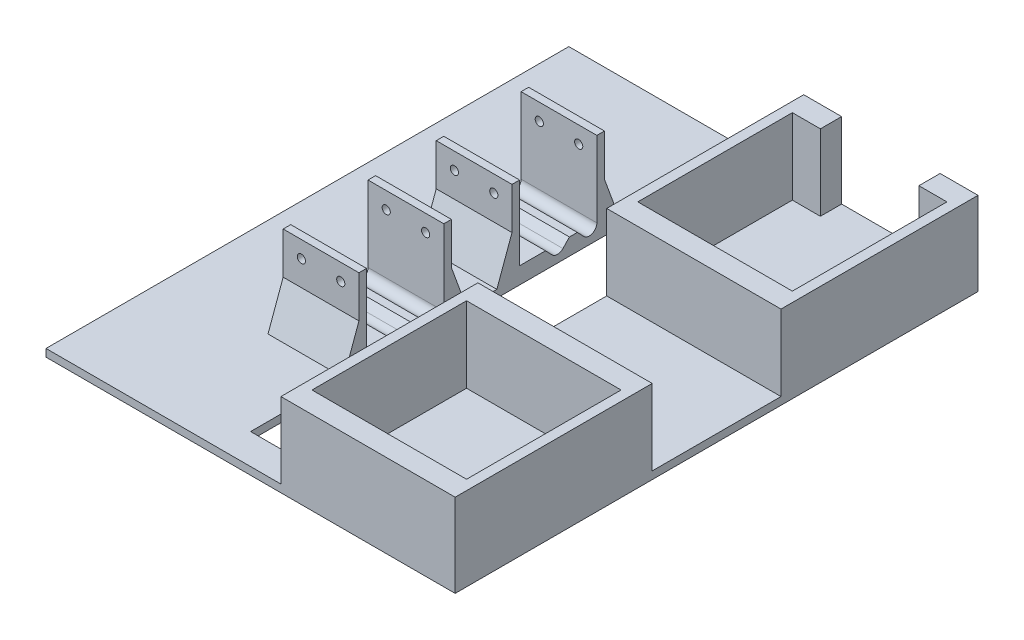
from build123d import *

# Parameters (mm, degrees)
SKETCH1_W               = 40
SKETCH1_H               = 305
BOSS_EXTRUDE1_DEPTH     = 5
SKETCH2_W               = 50
SKETCH2_H               = 5
BOSS_EXTRUDE2_DEPTH     = 55
CHAMFER1_SIZE           = 10
CHAMFER1_SIZE2          = 27.474774195
BOSS_EXTRUDE3_DEPTH     = 50
CUT_EXTRUDE1_DEPTH      = 372.822874498
CUT_EXTRUDE1_DEPTH_BACK = 372.822874498
SKETCH3_R               = 2.7
SKETCH5_W               = 115
SKETCH5_H               = 130
SKETCH5_W_2             = 102
SKETCH5_H_2             = 102
BOSS_EXTRUDE4_DEPTH     = 50
CUT_EXTRUDE2_DEPTH      = 443.18208919
CUT_EXTRUDE2_DEPTH_BACK = 50
SKETCH6_W               = 65
SKETCH6_H               = 50


with BuildPart() as part:
    # Sketch1 → Boss-Extrude1 (new body)
    with BuildSketch(Plane(origin=(0, 0, 0), x_dir=(1, 0, 0), z_dir=(0, 1, 0))):
        Polygon((0, 0), (115, 0), (155, 0), (270, 0), (270, 345), (155, 345), (115, 345), (0, 345), align=None)
        with Locations((135, 172.5)):
            Rectangle(SKETCH1_W, SKETCH1_H, mode=Mode.SUBTRACT)
    extrude(amount=BOSS_EXTRUDE1_DEPTH)

    # Sketch2 → Boss-Extrude2 (add)
    with BuildSketch(Plane(origin=(0, 5, 0), x_dir=(1, 0, 0), z_dir=(0, 1, 0))):
        with Locations((90, 251)):
            Rectangle(SKETCH2_W, SKETCH2_H)
        with Locations((90, 195)):
            Rectangle(SKETCH2_W, SKETCH2_H)
        with Locations((90, 150)):
            Rectangle(SKETCH2_W, SKETCH2_H)
        with Locations((90, 94)):
            Rectangle(SKETCH2_W, SKETCH2_H)
    extrude(amount=BOSS_EXTRUDE2_DEPTH)

    # Chamfer1
    chamfer1_edges = [part.edges().sort_by_distance(p)[0] for p in [
        (90, 5, -91.5),
        (90, 5, -152.5),
        (90, 5, -192.5),
        (90, 5, -253.5),
    ]]
    chamfer1_side = [part.faces().sort_by_distance(p)[0] for p in [
        (135, 5, -4.38092456),
    ]]
    chamfer(chamfer1_edges, length=CHAMFER1_SIZE, length2=CHAMFER1_SIZE2, reference=chamfer1_side[0])

    # Sketch4 → Boss-Extrude3 (add)
    with BuildSketch(Plane(origin=(115, 0, 0), x_dir=(0, 0, -1), z_dir=(1, 0, 0))):
        with BuildLine():
            Line((96.5, 11), (96.5, 5))
            Line((96.5, 5), (121.5, 5))
            ThreePointArc((121.5, 5), (119.541666648, 5.399464109), (117.896246851, 6.534027807))
            Line((117.896246851, 6.534027807), (113.601020514, 11))
            Line((113.601020514, 11), (96.5, 11))
        make_face()
        with BuildLine():
            ThreePointArc((125.103753149, 6.534027807), (123.458333352, 5.399464109), (121.5, 5))
            Line((121.5, 5), (142.5, 5))
            ThreePointArc((142.5, 5), (140.202150936, 5.559291759), (138.418369091, 7.112044127))
            Line((138.418369091, 7.112044127), (134.601020514, 11))
            Line((134.601020514, 11), (129.398979486, 11))
            Line((129.398979486, 11), (125.103753149, 6.534027807))
        make_face()
        with BuildLine():
            ThreePointArc((147.5, 10), (146.035533906, 6.464466094), (142.5, 5))
            Line((142.5, 5), (147.5, 5))
            Line((147.5, 5), (147.5, 10))
        make_face()
        with BuildLine():
            Line((197.5, 11), (197.5, 5))
            Line((197.5, 5), (222.5, 5))
            ThreePointArc((222.5, 5), (220.541666648, 5.399464109), (218.896246851, 6.534027807))
            Line((218.896246851, 6.534027807), (214.601020514, 11))
            Line((214.601020514, 11), (197.5, 11))
        make_face()
        with BuildLine():
            ThreePointArc((226.103753149, 6.534027807), (224.458333352, 5.399464109), (222.5, 5))
            Line((222.5, 5), (243.5, 5))
            ThreePointArc((243.5, 5), (241.541666648, 5.399464109), (239.896246851, 6.534027807))
            Line((239.896246851, 6.534027807), (235.601020514, 11))
            Line((235.601020514, 11), (230.398979486, 11))
            Line((230.398979486, 11), (226.103753149, 6.534027807))
        make_face()
        with BuildLine():
            ThreePointArc((248.5, 10), (247.035533906, 6.464466094), (243.5, 5))
            Line((243.5, 5), (248.5, 5))
            Line((248.5, 5), (248.5, 10))
        make_face()
    extrude(amount=-BOSS_EXTRUDE3_DEPTH)

    # Sketch3 → Cut-Extrude1 (cut, two sides: drawn at the far end of the back side and taken through both)
    with BuildSketch(Plane.XY.offset(-248.5).offset(-CUT_EXTRUDE1_DEPTH_BACK)):
        with Locations((77, 49)):
            Circle(SKETCH3_R)
        with Locations((103, 49)):
            Circle(SKETCH3_R)
    extrude(amount=CUT_EXTRUDE1_DEPTH + CUT_EXTRUDE1_DEPTH_BACK, mode=Mode.SUBTRACT)

    # Sketch5 → Boss-Extrude4 (add)
    # profile 1 of 2: a face of its own
    with BuildSketch(Plane(origin=(0, 5, 0), x_dir=(1, 0, 0), z_dir=(0, 1, 0))):
        with Locations((212.5, 65)):
            Rectangle(SKETCH5_W, SKETCH5_H)
        with Locations((212.5, 65)):
            Rectangle(SKETCH5_W_2, SKETCH5_H_2, mode=Mode.SUBTRACT)
    # profile 2 of 2: a face of its own
    with BuildSketch(Plane(origin=(0, 5, 0), x_dir=(1, 0, 0), z_dir=(0, 1, 0))):
        with Locations((212.5, 280)):
            Rectangle(SKETCH5_W, SKETCH5_H)
        with Locations((212.5, 280)):
            Rectangle(SKETCH5_W_2, SKETCH5_H_2, mode=Mode.SUBTRACT)
    extrude(amount=BOSS_EXTRUDE4_DEPTH)

    # Sketch6 → Cut-Extrude2 (cut, two sides: drawn at the far end of the back side and taken through both)
    with BuildSketch(Plane(origin=(0, 0, -345), x_dir=(-1, 0, 0), z_dir=(0, 0, -1)).offset(-CUT_EXTRUDE2_DEPTH_BACK)):
        with Locations((-212.5, 30)):
            Rectangle(SKETCH6_W, SKETCH6_H)
    extrude(amount=CUT_EXTRUDE2_DEPTH + CUT_EXTRUDE2_DEPTH_BACK, mode=Mode.SUBTRACT)


solid = part.part
